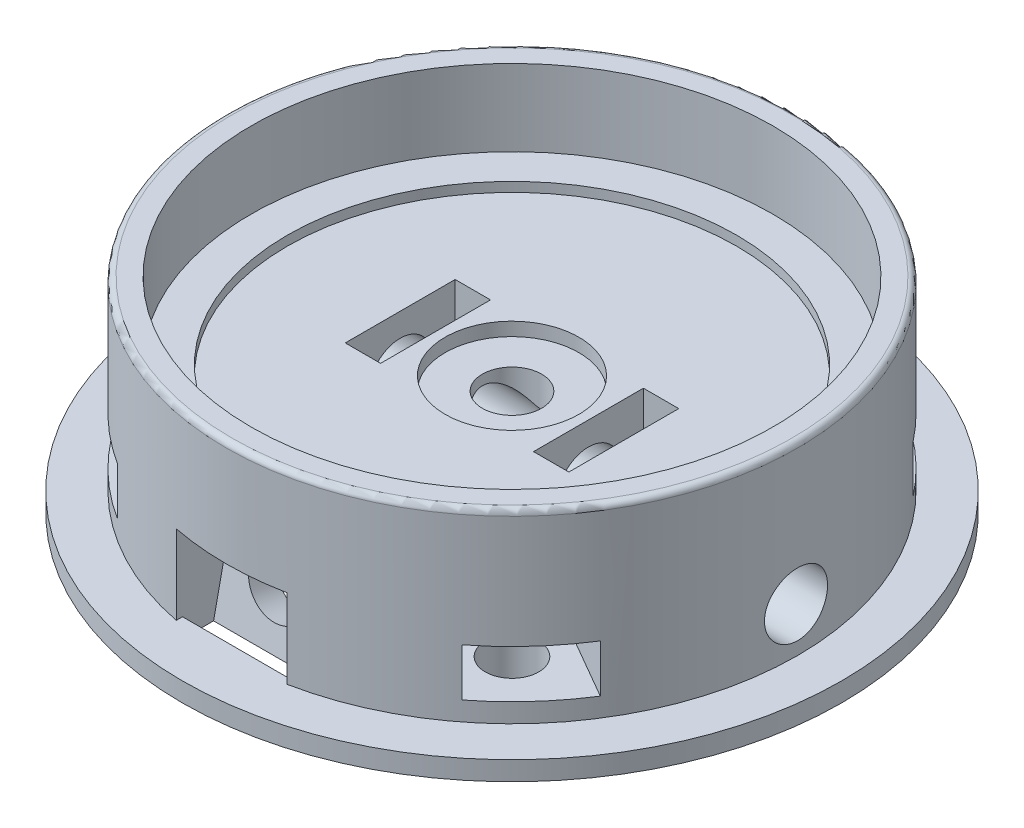
from build123d import *

# Parameters (mm, degrees)
SKETCH1_R           = 14.95
BOSS_EXTRUDE1_DEPTH = 5.7
SKETCH2_R           = 11.75
CUT_EXTRUDE1_DEPTH  = 0.5
SKETCH3_R           = 14.95
SKETCH3_R_2         = 13.65
BOSS_EXTRUDE2_DEPTH = 4
FILLET1_R           = 0.3
SKETCH4_R           = 1.55
CUT_EXTRUDE2_DEPTH  = 22.772574492
SKETCH5_R           = 1.65
CUT_EXTRUDE3_DEPTH  = 24.261448794
SKETCH6_R           = 17.25
SKETCH6_R_2         = 1.55
BOSS_EXTRUDE3_DEPTH = 1
SKETCH7_W           = 5.75
SKETCH7_H           = 5.75
CUT_EXTRUDE4_DEPTH  = 1.85
CIRPATTERN1_COUNT   = 2
CUT_EXTRUDE5_START  = -2
SKETCH9_R           = 1.65
CUT_EXTRUDE5_DEPTH  = 38.5453624
CUT_EXTRUDE6_DEPTH  = 1.8
CUT_EXTRUDE11_REACH = 39.795
SKETCH19_W          = 5.8
SKETCH19_H          = 4.150072675
CIRPATTERN2_COUNT   = 2
SKETCH16_R          = 1.4
CUT_EXTRUDE8_DEPTH  = 4.5
CUT_EXTRUDE9_DEPTH  = 2.5
CIRPATTERN3_COUNT   = 4
SKETCH18_R          = 3.5
CUT_EXTRUDE10_DEPTH = 0.7


with BuildPart() as part:
    # Sketch1 → Boss-Extrude1 (new body)
    with BuildSketch(Plane(origin=(0, 0, 0), x_dir=(1, 0, 0), z_dir=(0, 1, 0))):
        Circle(SKETCH1_R)
    extrude(amount=BOSS_EXTRUDE1_DEPTH)

    # Sketch2 → Cut-Extrude1 (cut)
    with BuildSketch(Plane(origin=(0, 5.7, 0), x_dir=(1, 0, 0), z_dir=(0, 1, 0))):
        Circle(SKETCH2_R)
    extrude(amount=-CUT_EXTRUDE1_DEPTH, mode=Mode.SUBTRACT)

    # Sketch3 → Boss-Extrude2 (add)
    with BuildSketch(Plane(origin=(0, 5.7, 0), x_dir=(1, 0, 0), z_dir=(0, 1, 0))):
        Circle(SKETCH3_R)
        Circle(SKETCH3_R_2, mode=Mode.SUBTRACT)
    extrude(amount=BOSS_EXTRUDE2_DEPTH)

    # Fillet1
    fillet1_edges = [part.edges().sort_by_distance(p)[0] for p in [
        (-14.95, 9.7, 0),
    ]]
    fillet(fillet1_edges, radius=FILLET1_R)

    # Sketch4 → Cut-Extrude2 (cut, through all)
    with BuildSketch(Plane(origin=(0, 5.2, 0), x_dir=(1, 0, 0), z_dir=(0, 1, 0))):
        Circle(SKETCH4_R)
    extrude(amount=-CUT_EXTRUDE2_DEPTH, mode=Mode.SUBTRACT)

    # Sketch5 → Cut-Extrude3 (cut, through all)
    with BuildSketch(Plane(origin=(0, 0, 0), x_dir=(0, 0, -1), z_dir=(1, 0, 0))):
        with Locations((0, 2.325)):
            Circle(SKETCH5_R)
    cut_extrude3 = extrude(amount=CUT_EXTRUDE3_DEPTH, mode=Mode.SUBTRACT)

    # Sketch6 → Boss-Extrude3 (add)
    with BuildSketch(Plane.XZ):
        Circle(SKETCH6_R)
        Circle(SKETCH6_R_2, mode=Mode.SUBTRACT)
    extrude(amount=BOSS_EXTRUDE3_DEPTH)

    # Sketch7 → Cut-Extrude4 (cut)
    with BuildSketch(Plane(origin=(4, 0, 0), x_dir=(0, 0, -1), z_dir=(1, 0, 0))):
        with Locations((0, 2.325)):
            Rectangle(SKETCH7_W, SKETCH7_H)
    cut_extrude4 = extrude(amount=CUT_EXTRUDE4_DEPTH, mode=Mode.SUBTRACT)

    # CirPattern1: Cut-Extrude3, Cut-Extrude4 ×2 about axis
    cirpattern1_axis = Axis((0, 9.4, 0), (0, -1, 0))
    add([cut_extrude3.rotate(cirpattern1_axis, i * 360 / CIRPATTERN1_COUNT) for i in range(1, CIRPATTERN1_COUNT)], mode=Mode.SUBTRACT)
    add([cut_extrude4.rotate(cirpattern1_axis, i * 360 / CIRPATTERN1_COUNT) for i in range(1, CIRPATTERN1_COUNT)], mode=Mode.SUBTRACT)

    # Sketch9 → Cut-Extrude5 (cut)
    with BuildSketch(Plane(origin=(0, 0.418934665, 12.410952688), x_dir=(0, -0.9781476007338056, 0.2079116908177598), z_dir=(0, 0.2079116908177598, 0.9781476007338056)).offset(CUT_EXTRUDE5_START)):
        with Locations((-1.471706086, 0)):
            Circle(SKETCH9_R)
    cut_extrude5 = extrude(amount=CUT_EXTRUDE5_DEPTH, mode=Mode.SUBTRACT)

    # Sketch10 → Cut-Extrude6 (cut)
    with BuildSketch(Plane(origin=(0, 0, 12.5), x_dir=(0, -0.9781476007338056, 0.2079116908177598), z_dir=(0, 0.2079116908177598, 0.9781476007338056))):
        Polygon((1, 2.9), (-4.8, 2.9), (-4.8, -2.9), (1, -2.9), (3, -2.9), (3, 2.9), align=None)
    cut_extrude6 = extrude(amount=CUT_EXTRUDE6_DEPTH, mode=Mode.SUBTRACT)

    # Cut-Sweep1: sweep along a path in Sketch14
    with BuildLine(Plane(origin=(0, 0, 0), x_dir=(0, -1, 0), z_dir=(-1, 0, 0))) as cut_sweep1_path:
        ThreePointArc((-3.160556446, 10.294692096), (-0.851753645, 4.580204634), (3.272281132, 0))
    # Sketch13 → Cut-Sweep1 (sweep, cut)
    with BuildSketch(Plane(origin=(0, 2.230236483, 10.492437709), x_dir=(-1, 0, 0), z_dir=(0, 0.2079116908177598, 0.9781476007338056))):
        with BuildLine():
            Line((-2.490185445, -0.207457245), (-3.875584776, 3.598896135))
            Line((-3.875584776, 3.598896135), (3.875584776, 3.598896135))
            Line((3.875584776, 3.598896135), (2.490185445, -0.207457245))
            ThreePointArc((2.490185445, -0.207457245), (0, -1.951103865), (-2.490185445, -0.207457245))
        make_face()
    cut_sweep1 = sweep(path=cut_sweep1_path.line, mode=Mode.SUBTRACT)

    # Cut-Extrude11: up to this plane
    cut_extrude11_end = Plane(origin=(0, 2.916345063, 13.720324792), z_dir=(0, -0.20791169081775973, -0.9781476007338056))
    # Sketch19 → Cut-Extrude11 (cut, up to the surface)
    with BuildSketch(Plane.XY.offset(14.95), mode=Mode.PRIVATE) as cut_extrude11_sk1:
        with Locations((0, 2.075036338)):
            Rectangle(SKETCH19_W, SKETCH19_H)
    cut_extrude11_tool1 = split(extrude(cut_extrude11_sk1.sketch, amount=-CUT_EXTRUDE11_REACH, mode=Mode.PRIVATE), bisect_by=cut_extrude11_end, keep=Keep.BOTH, mode=Mode.PRIVATE)
    cut_extrude11 = cut_extrude11_tool1.solids().sort_by_distance((0, 2.075036, 14.95))[0]
    add(cut_extrude11, mode=Mode.SUBTRACT)

    # CirPattern2: Cut-Extrude5, Cut-Extrude6, Cut-Sweep1, Cut-Extrude11 ×2 about axis
    cirpattern2_axis = Axis((0, 9.4, 0), (0, -1, 0))
    add([cut_extrude5.rotate(cirpattern2_axis, i * 360 / CIRPATTERN2_COUNT) for i in range(1, CIRPATTERN2_COUNT)], mode=Mode.SUBTRACT)
    add([cut_extrude6.rotate(cirpattern2_axis, i * 360 / CIRPATTERN2_COUNT) for i in range(1, CIRPATTERN2_COUNT)], mode=Mode.SUBTRACT)
    add([cut_sweep1.rotate(cirpattern2_axis, i * 360 / CIRPATTERN2_COUNT) for i in range(1, CIRPATTERN2_COUNT)], mode=Mode.SUBTRACT)
    add([cut_extrude11.rotate(cirpattern2_axis, i * 360 / CIRPATTERN2_COUNT) for i in range(1, CIRPATTERN2_COUNT)], mode=Mode.SUBTRACT)

    # Sketch16 → Cut-Extrude8 (cut)
    with BuildSketch(Plane.XZ.offset(1)):
        with Locations((-8.520636713, 8.520636713)):
            Circle(SKETCH16_R)
    cut_extrude8 = extrude(amount=-CUT_EXTRUDE8_DEPTH, mode=Mode.SUBTRACT)

    # Sketch17 → Cut-Extrude9 (cut)
    with BuildSketch(Plane.XZ.offset(-3.5)):
        Polygon((-11.407388059, 8.520636713), (-9.964012386, 6.020636713), (-7.07726104, 6.020636713), (-5.633885367, 8.520636713), (-7.07726104, 11.020636713), (-8.0108701, 12.63769504), (-12.340997119, 10.13769504), align=None)
    cut_extrude9 = extrude(amount=CUT_EXTRUDE9_DEPTH, mode=Mode.SUBTRACT)

    # CirPattern3: Cut-Extrude8, Cut-Extrude9 ×4 about axis
    cirpattern3_axis = Axis((0, 9.4, 0), (0, -1, 0))
    add([cut_extrude8.rotate(cirpattern3_axis, i * 360 / CIRPATTERN3_COUNT) for i in range(1, CIRPATTERN3_COUNT)], mode=Mode.SUBTRACT)
    add([cut_extrude9.rotate(cirpattern3_axis, i * 360 / CIRPATTERN3_COUNT) for i in range(1, CIRPATTERN3_COUNT)], mode=Mode.SUBTRACT)

    # Sketch18 → Cut-Extrude10 (cut)
    with BuildSketch(Plane(origin=(0, 5.2, 0), x_dir=(1, 0, 0), z_dir=(0, 1, 0))):
        Circle(SKETCH18_R)
    extrude(amount=-CUT_EXTRUDE10_DEPTH, mode=Mode.SUBTRACT)


solid = part.part
